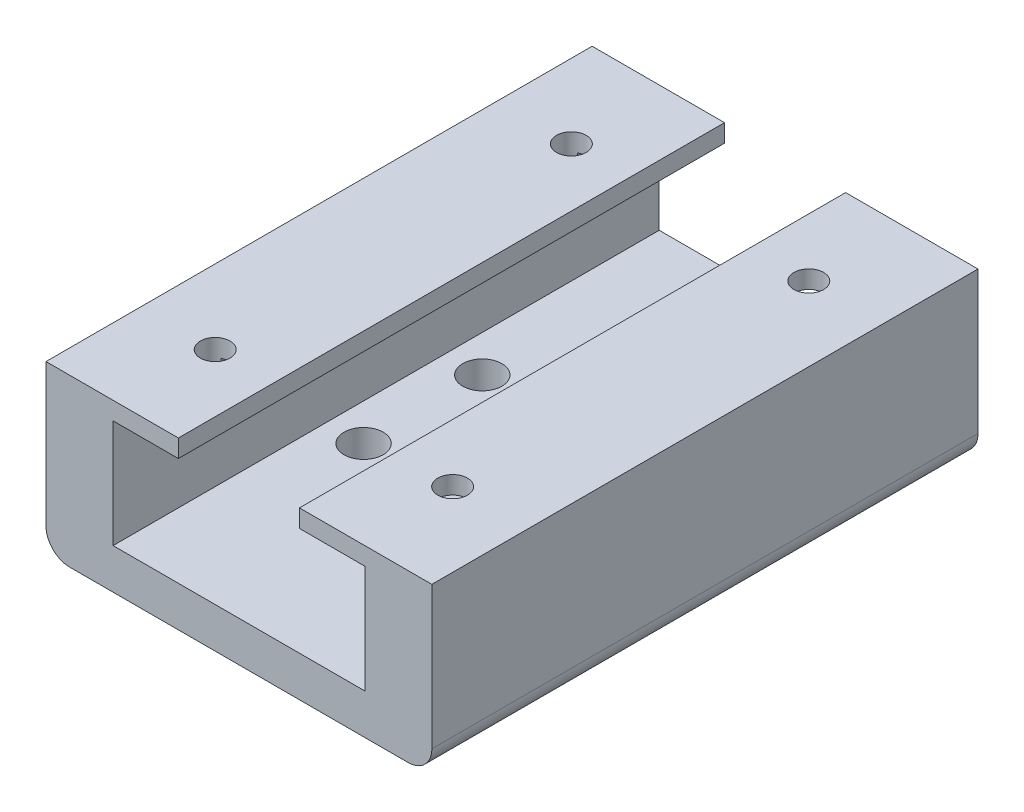
from build123d import *

# Parameters (mm, degrees)
SKETCH_1_W          = 32.5
SKETCH_1_H          = 46
EXTRUDE_1_DEPTH     = 14
CUT_EXTRUDE_2_DEPTH = 51.754925869
CUT_EXTRUDE_3_REACH = 33.449
SKETCH_4_R          = 1.65
SKETCH_5_R          = 1.25
CUT_EXTRUDE_4_DEPTH = 2
FILLET_1_R          = 2


with BuildPart() as part:
    # 草图1 → 凸台-拉伸1 (new body)
    with BuildSketch(Plane(origin=(0, 0, 0), x_dir=(1, 0, 0), z_dir=(0, 1, 0))):
        Rectangle(SKETCH_1_W, SKETCH_1_H)
    extrude(amount=EXTRUDE_1_DEPTH)

    # 草图2 → 切除-拉伸2 (cut, through all)
    with BuildSketch(Plane(origin=(0, 0, -23), x_dir=(-1, 0, 0), z_dir=(0, 0, -1))):
        Polygon((-5.1, 14), (-5.1, 12.5), (-10.6, 12.5), (-10.6, 3.4), (10.6, 3.4), (10.6, 12.5), (5.1, 12.5), (5.1, 14), align=None)
    extrude(amount=-CUT_EXTRUDE_2_DEPTH, mode=Mode.SUBTRACT)

    # 草图4 → 切除-拉伸3 (cut, up to next)
    with BuildSketch(Plane.XZ, mode=Mode.PRIVATE) as cut_extrude_3_sk1:
        with Locations((-7.5, 5)):
            Circle(SKETCH_4_R)
    cut_extrude_3_tool1 = extrude(cut_extrude_3_sk1.sketch, amount=-CUT_EXTRUDE_3_REACH, mode=Mode.PRIVATE) & part.part
    # 草图4 → 切除-拉伸3 (cut, up to next)
    with BuildSketch(Plane.XZ, mode=Mode.PRIVATE) as cut_extrude_3_sk2:
        with Locations((7.5, 5)):
            Circle(SKETCH_4_R)
    cut_extrude_3_tool2 = extrude(cut_extrude_3_sk2.sketch, amount=-CUT_EXTRUDE_3_REACH, mode=Mode.PRIVATE) & part.part
    # 草图4 → 切除-拉伸3 (cut, up to next)
    with BuildSketch(Plane.XZ, mode=Mode.PRIVATE) as cut_extrude_3_sk3:
        with Locations((7.5, -5)):
            Circle(SKETCH_4_R)
    cut_extrude_3_tool3 = extrude(cut_extrude_3_sk3.sketch, amount=-CUT_EXTRUDE_3_REACH, mode=Mode.PRIVATE) & part.part
    # 草图4 → 切除-拉伸3 (cut, up to next)
    with BuildSketch(Plane.XZ, mode=Mode.PRIVATE) as cut_extrude_3_sk4:
        with Locations((-7.5, -5)):
            Circle(SKETCH_4_R)
    cut_extrude_3_tool4 = extrude(cut_extrude_3_sk4.sketch, amount=-CUT_EXTRUDE_3_REACH, mode=Mode.PRIVATE) & part.part
    add(cut_extrude_3_tool1.solids().sort_by_distance((-7.5, 0, 5))[0], mode=Mode.SUBTRACT)
    add(cut_extrude_3_tool2.solids().sort_by_distance((7.5, 0, 5))[0], mode=Mode.SUBTRACT)
    add(cut_extrude_3_tool3.solids().sort_by_distance((7.5, 0, -5))[0], mode=Mode.SUBTRACT)
    add(cut_extrude_3_tool4.solids().sort_by_distance((-7.5, 0, -5))[0], mode=Mode.SUBTRACT)

    # 草图5 → 切除-拉伸4 (cut)
    with BuildSketch(Plane(origin=(0, 14, 0), x_dir=(1, 0, 0), z_dir=(0, 1, 0))):
        with Locations((-10, 15)):
            Circle(SKETCH_5_R)
        with Locations((10, 15)):
            Circle(SKETCH_5_R)
        with Locations((10, -15)):
            Circle(SKETCH_5_R)
        with Locations((-10, -15)):
            Circle(SKETCH_5_R)
    extrude(amount=-CUT_EXTRUDE_4_DEPTH, mode=Mode.SUBTRACT)

    # 圆角1
    fillet_1_edges = [part.edges().sort_by_distance(p)[0] for p in [
        (16.25, 0, 0),
        (-16.25, 0, 0),
    ]]
    fillet(fillet_1_edges, radius=FILLET_1_R)


solid = part.part
